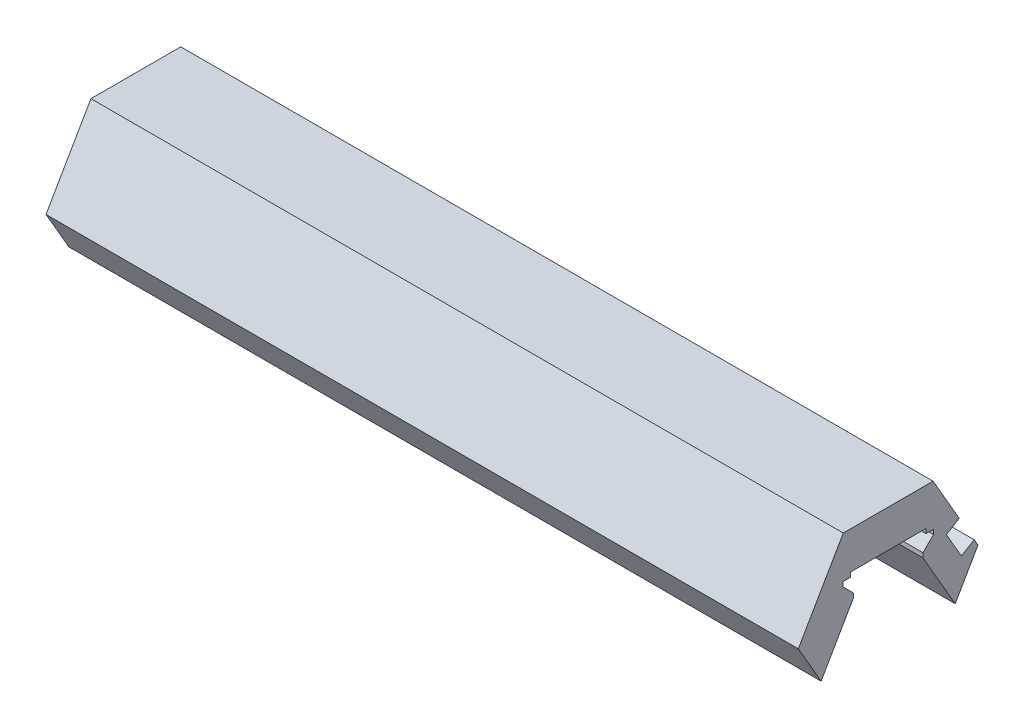
from build123d import *

# Parameters (mm, degrees)
BOSS_EXTRUDE2_DEPTH = 50.25
SKETCH2_W           = 100.5
SKETCH2_H           = 4
CUT_EXTRUDE1_DEPTH  = 2


with BuildPart() as part:
    # LED Segment → Boss-Extrude2 (new, symmetric)
    with BuildSketch(Plane(origin=(0, 0, 0), x_dir=(0, 0, -1), z_dir=(1, 0, 0))):
        Polygon((8.957863896, -5.269134295), (12, 0), (6, 10.392304845), (-6, 10.392304845), (-12, 0), (-8.957863896, -5.269134295), (-4.65, 2.192304845), (-4.65, 2.792304845), (-6.05, 4.192304845), (-6.05, 4.792304845), (-5.05, 4.792304845), (-5.05, 5.392304845), (5.05, 5.392304845), (5.05, 4.792304845), (6.05, 4.792304845), (6.05, 4.192304845), (4.65, 2.792304845), (4.65, 2.192304845), align=None)
    extrude(amount=BOSS_EXTRUDE2_DEPTH, both=True)

    # Sketch2 → Cut-Extrude1 (cut)
    with BuildSketch(Plane(origin=(0, 5.196152423, -9), x_dir=(-1, 0, 0), z_dir=(0, 0.5000000000000004, -0.8660254037844384))):
        with Locations((0, -3)):
            Rectangle(SKETCH2_W, SKETCH2_H)
    extrude(amount=-CUT_EXTRUDE1_DEPTH, mode=Mode.SUBTRACT)


solid = part.part
